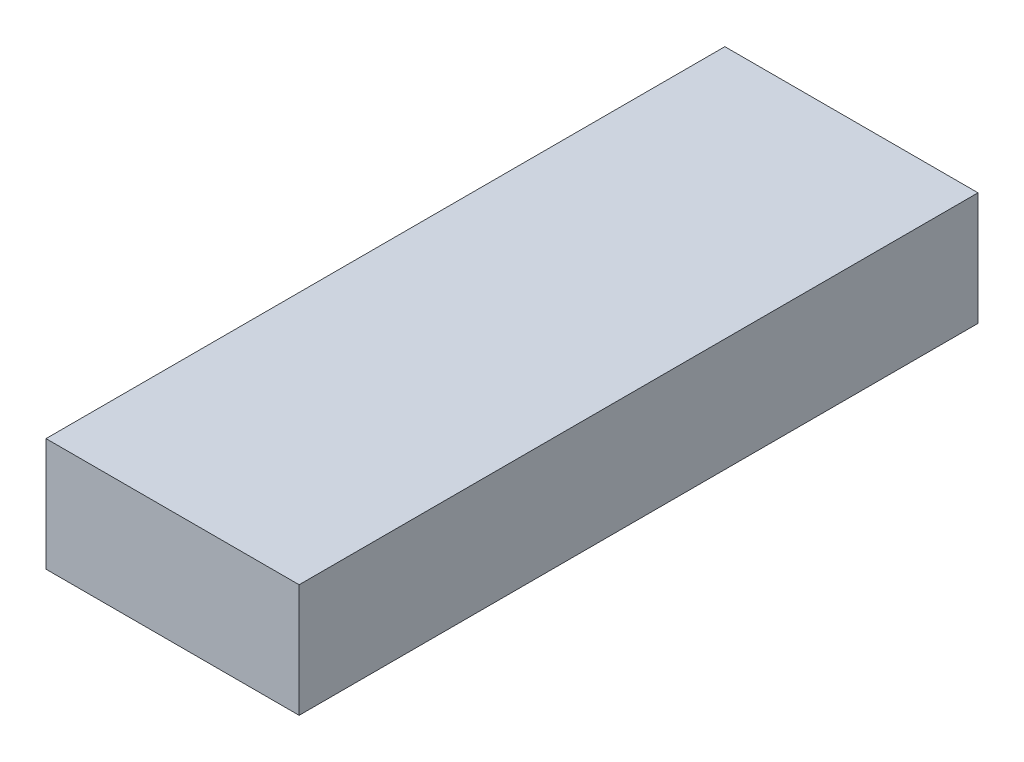
from build123d import *

# Parameters (mm, degrees)
SKETCH1_W           = 16.6624
SKETCH1_H           = 37.2872
BOSS_EXTRUDE1_DEPTH = 50


with BuildPart() as part:
    # Sketch1 → Boss-Extrude1 (new, symmetric)
    with BuildSketch(Plane(origin=(0, 0, 0), x_dir=(0, 1, 0), z_dir=(0, 0, 1))):
        Rectangle(SKETCH1_W, SKETCH1_H)
    extrude(amount=BOSS_EXTRUDE1_DEPTH, both=True)


solid = part.part
